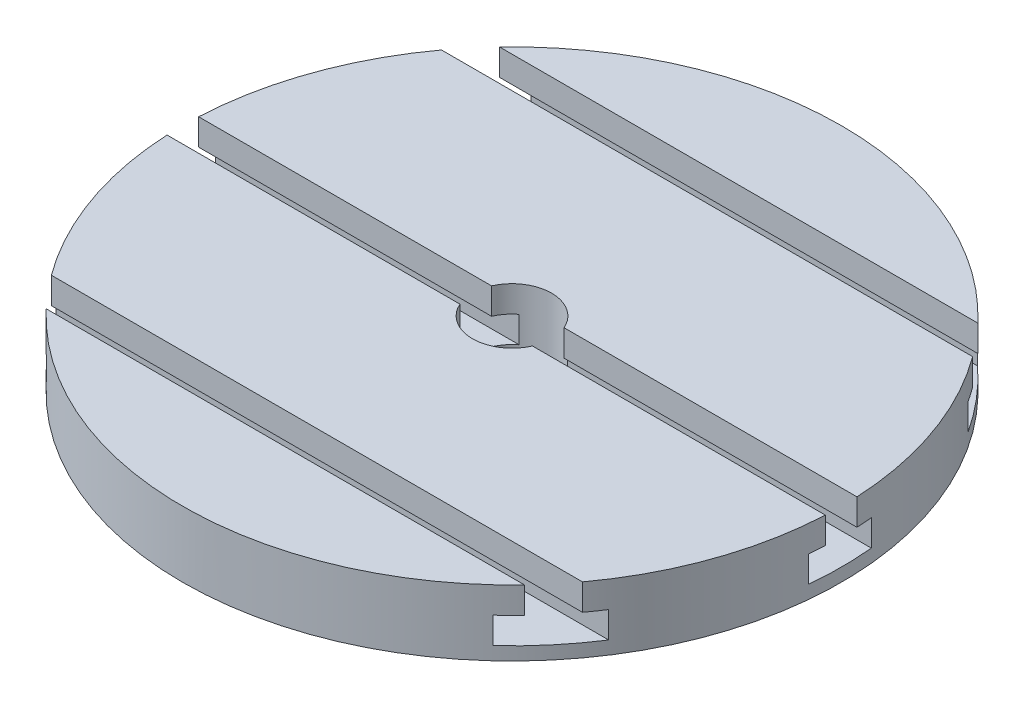
from build123d import *

# Parameters (mm, degrees)
SKETCH_1_W          = 110
SKETCH_1_H          = 25
CUT_EXTRUDE_1_DEPTH = 150


with BuildPart() as part:
    # Эскиз1 → Повернуть1 (revolve)
    with BuildSketch(Plane(origin=(0, 0, 0), x_dir=(0, 0, -1), z_dir=(1, 0, 0))):
        with Locations((70, 12.5)):
            Rectangle(SKETCH_1_W, SKETCH_1_H)
    revolve(axis=Axis((0, -12.628115938, 0), (0, 1, 0)))

    # Эскиз2 → Вырез-Вытянуть1 (cut, symmetric)
    with BuildSketch(Plane(origin=(0, 0, 0), x_dir=(0, 0, -1), z_dir=(1, 0, 0))):
        Polygon((11.873389283, 5), (11.873389283, 15), (6, 15), (6, 25), (-6, 25), (-6, 15), (-11.873389283, 15), (-11.873389283, 5), align=None)
        Polygon((68.126610717, 5), (91.873389283, 5), (91.873389283, 15), (86, 15), (86, 25), (74, 25), (74, 15), (68.126610717, 15), align=None)
        Polygon((-91.873389283, 5), (-68.126610717, 5), (-68.126610717, 15), (-74, 15), (-74, 25), (-86, 25), (-86, 15), (-91.873389283, 15), align=None)
    extrude(amount=CUT_EXTRUDE_1_DEPTH, both=True, mode=Mode.SUBTRACT)


solid = part.part
